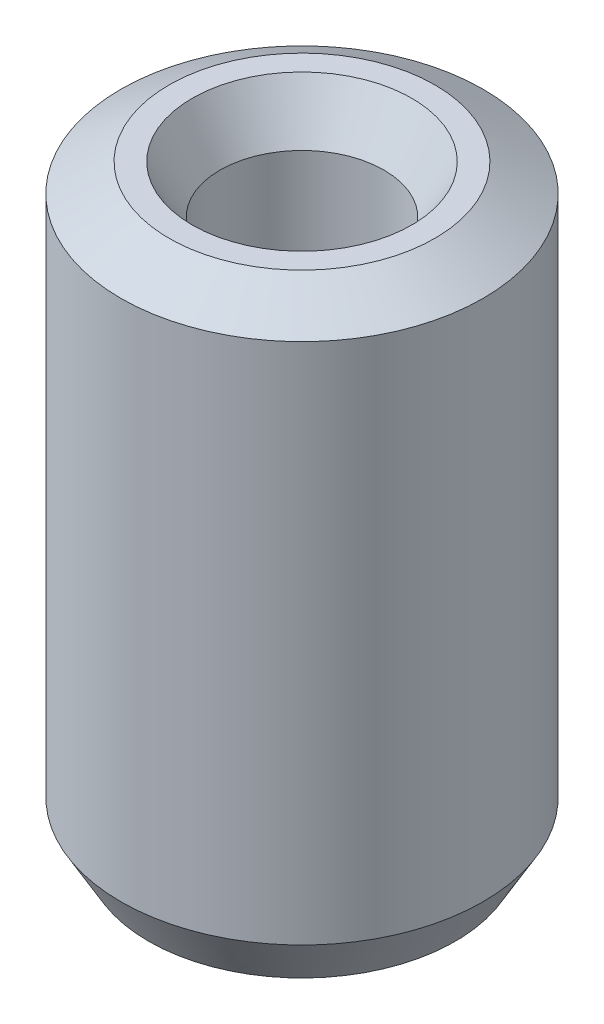
from build123d import *
from OCP.BRepFilletAPI import BRepFilletAPI_MakeChamfer

# Parameters (mm, degrees)
SKETCH1_R           = 17.5
BOSS_EXTRUDE1_DEPTH = 57.831294133
SKETCH2_R           = 7.917502681
CUT_EXTRUDE1_DEPTH  = 63.904360589
CHAMFER1_SIZE       = 2.690228219
CHAMFER1_SIZE2      = 4.65961196


with BuildPart() as part:
    # Sketch1 → Boss-Extrude1 (new body)
    with BuildSketch(Plane(origin=(0, 0, 0), x_dir=(1, 0, 0), z_dir=(0, 1, 0))):
        Circle(SKETCH1_R)
    extrude(amount=BOSS_EXTRUDE1_DEPTH)

    # Sketch2 → Cut-Extrude1 (cut, through all)
    with BuildSketch(Plane(origin=(0, 0, 0), x_dir=(1, 0, 0), z_dir=(0, 1, 0))):
        Circle(SKETCH2_R)
    extrude(amount=CUT_EXTRUDE1_DEPTH, mode=Mode.SUBTRACT)

    # Chamfer1: one chamfer whose edges measure the first distance from different faces: ONE call of the kernel's chamfer builder (chamfer() names one face for all edges)
    chamfer1_edges_1 = [part.edges().sort_by_distance(p)[0] for p in [
        (-7.917502681, 57.831294133, 0),
    ]]
    chamfer1_side_1 = [part.faces().sort_by_distance(p)[0] for p in [
        (-17.005025253, 57.831294133, 0),
    ]]
    chamfer1_edges_2 = [part.edges().sort_by_distance(p)[0] for p in [
        (-7.917502681, 0, 0),
    ]]
    chamfer1_side_2 = [part.faces().sort_by_distance(p)[0] for p in [
        (-7.917502681, 28.915647066, 0),
    ]]
    chamfer1_edges_3 = [part.edges().sort_by_distance(p)[0] for p in [
        (-17.5, 0, 0),
    ]]
    chamfer1_side_3 = [part.faces().sort_by_distance(p)[0] for p in [
        (-17.005025253, 0, 0),
    ]]
    chamfer1_edges_4 = [part.edges().sort_by_distance(p)[0] for p in [
        (-17.5, 57.831294133, 0),
    ]]
    chamfer1_side_4 = [part.faces().sort_by_distance(p)[0] for p in [
        (-17.5, 28.915647066, 0),
    ]]
    chamfer1 = BRepFilletAPI_MakeChamfer(part.part.solid().wrapped)
    for e in chamfer1_edges_1:
        chamfer1.Add(CHAMFER1_SIZE, CHAMFER1_SIZE2, e.wrapped, chamfer1_side_1[0].wrapped)  # the first distance lies on this face
    for e in chamfer1_edges_2:
        chamfer1.Add(CHAMFER1_SIZE, CHAMFER1_SIZE2, e.wrapped, chamfer1_side_2[0].wrapped)  # the first distance lies on this face
    for e in chamfer1_edges_3:
        chamfer1.Add(CHAMFER1_SIZE, CHAMFER1_SIZE2, e.wrapped, chamfer1_side_3[0].wrapped)  # the first distance lies on this face
    for e in chamfer1_edges_4:
        chamfer1.Add(CHAMFER1_SIZE, CHAMFER1_SIZE2, e.wrapped, chamfer1_side_4[0].wrapped)  # the first distance lies on this face
    add(Compound.cast(chamfer1.Shape()), mode=Mode.REPLACE)


solid = part.part
